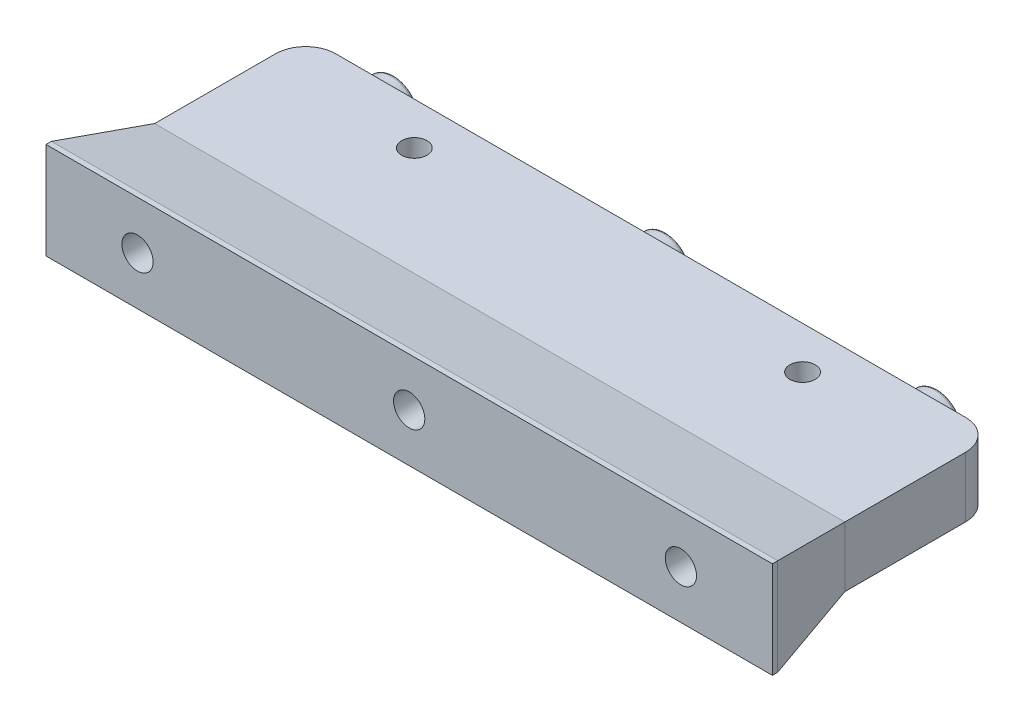
from build123d import *

# Parameters (mm, degrees)
BOSS_EXTRUDE1_DEPTH      = 5
BOSS_EXTRUDE1_DEPTH_BACK = 5
SKETCH2_R                = 2.1
FILLET1_R                = 5
SKETCH14_W               = 120.3
SKETCH14_H               = 16
BOSS_EXTRUDE3_DEPTH      = 15
F_5MBOLTS_DEPTH          = 70.07258863
F_5MBOLTS_DEPTH_BACK     = 70.07258863
SKETCH12_R               = 2.59
SKETCH13_R               = 4.35
SKETCH13_R_2             = 2.59
TOPWASHER_DEPTH          = 2.5
WASHERFILLET_R           = 0.5
CHAMFER1_SIZE            = 3
CHAMFER1_SIZE_2          = 14.113890328


# Read off the part's stored shape, not the designer's step: AdvancedHole1, AdvancedHole2
with BuildPart() as part:
    # Sketch2 → Boss-Extrude1 (new, two sides: drawn at the far end of the back side and taken through both)
    with BuildSketch(Plane(origin=(0, 0, 0), x_dir=(1, 0, 0), z_dir=(0, 1, 0)).offset(-BOSS_EXTRUDE1_DEPTH_BACK)):
        Polygon((-57.15, 5), (-57.15, -33), (57.15, -33), (57.15, 5), (57.15, 7), (-57.15, 7), align=None)
        with Locations(Location((-32.15, 0, 0), (0, 0, 270))):
            Circle(SKETCH2_R, mode=Mode.SUBTRACT)
        with Locations(Location((32.15, 0, 0), (0, 0, 90))):
            Circle(SKETCH2_R, mode=Mode.SUBTRACT)
    extrude(amount=BOSS_EXTRUDE1_DEPTH + BOSS_EXTRUDE1_DEPTH_BACK)

    # AdvancedHole1 outline → AdvancedHole1 (revolve, cut)
    with BuildSketch(Plane(origin=(32.15, 0, 0), x_dir=(1, 0, 0), z_dir=(0, 0, 1))):
        Polygon((2.25, -2.55), (2.1, -2.55), (2.1, -5), (4.7, -5), align=None)
    revolve(axis=Axis((32.15, 0, 0), (0, 1, 0)), mode=Mode.SUBTRACT)

    # AdvancedHole2 outline → AdvancedHole2 (revolve, cut)
    with BuildSketch(Plane(origin=(-32.15, 0, 0), x_dir=(1, 0, 0), z_dir=(0, 0, 1))):
        Polygon((2.25, -2.55), (2.1, -2.55), (2.1, -5), (4.7, -5), align=None)
    revolve(axis=Axis((-32.15, 0, 0), (0, 1, 0)), mode=Mode.SUBTRACT)

    # Fillet1
    fillet1_edges = [part.edges().sort_by_distance(p)[0] for p in [
        (-57.15, 0, -7),
        (57.15, 0, -7),
    ]]
    fillet(fillet1_edges, radius=FILLET1_R)

    # Sketch14 → Boss-Extrude3 (add)
    with BuildSketch(Plane.XY.offset(33)):
        Rectangle(SKETCH14_W, SKETCH14_H)
    extrude(amount=-BOSS_EXTRUDE3_DEPTH)

    # Sketch12 → 5mBolts (cut, two sides: drawn at the far end of the back side and taken through both)
    with BuildSketch(Plane.XY.offset(-F_5MBOLTS_DEPTH_BACK)):
        with Locations((-45, 0)):
            Circle(SKETCH12_R)
        with Locations(Location((45, 0, 0), (0, 0, 180))):
            Circle(SKETCH12_R)
        Circle(SKETCH12_R)
    extrude(amount=F_5MBOLTS_DEPTH + F_5MBOLTS_DEPTH_BACK, mode=Mode.SUBTRACT)

    # Sketch13 → TopWasher (add)
    # profile 1 of 3: a face of its own
    with BuildSketch(Plane(origin=(0, 0, -7), x_dir=(-1, 0, 0), z_dir=(0, 0, -1))):
        with Locations((-45, 0)):
            Circle(SKETCH13_R)
        with Locations((-45, 0)):
            Circle(SKETCH13_R_2, mode=Mode.SUBTRACT)
    # profile 2 of 3: a face of its own
    with BuildSketch(Plane(origin=(0, 0, -7), x_dir=(-1, 0, 0), z_dir=(0, 0, -1))):
        with Locations(Location((45, 0, 0), (0, 0, 180))):
            Circle(SKETCH13_R)
        with Locations(Location((45, 0, 0), (0, 0, 180))):
            Circle(SKETCH13_R_2, mode=Mode.SUBTRACT)
    # profile 3 of 3: a face of its own
    with BuildSketch(Plane(origin=(0, 0, -7), x_dir=(-1, 0, 0), z_dir=(0, 0, -1))):
        Circle(SKETCH13_R)
        with Locations(Location((0, 0, 0), (0, 0, 180))):
            Circle(SKETCH13_R_2, mode=Mode.SUBTRACT)
    extrude(amount=TOPWASHER_DEPTH)

    # WasherFillet
    washerfillet_edges = [part.edges().sort_by_distance(p)[0] for p in [
        (49.35, 0, -9.5),
        (49.35, 0, -7),
        (-49.35, 0, -9.5),
        (-49.35, 0, -7),
        (4.35, 0, -9.5),
        (4.35, 0, -7),
    ]]
    fillet(washerfillet_edges, radius=WASHERFILLET_R)

    # Chamfer1
    # the kernel refuses this chamfer: 14.113890328, 3 mm, written as the material it takes off along each edge
    with BuildSketch(Plane(origin=(-60.15, -44.666446864, 18), x_dir=(0.984670194927414, 0, -0.17442650951506342), z_dir=(0, 1, 0))) as chamfer1_piece_1_section:
        Polygon((CHAMFER1_SIZE * 0.984670194927, -CHAMFER1_SIZE * 0.174426509515), (-CHAMFER1_SIZE_2 * 0.17442650952, -CHAMFER1_SIZE_2 * 0.984670194958), (0, 0), align=None)
    chamfer1_piece_1 = extrude(amount=89.332893728, mode=Mode.PRIVATE)
    chamfer1_piece_1 = split(chamfer1_piece_1, bisect_by=Plane(origin=(-59.308334222, -5, 23.00362874), z_dir=(0, -1, 0)), keep=Keep.TOP, mode=Mode.PRIVATE)
    chamfer1_piece_1 = split(chamfer1_piece_1, bisect_by=Plane(origin=(-57.15, -24.833223432, 23.00362874), z_dir=(-1, 0, 0)), keep=Keep.TOP, mode=Mode.PRIVATE)
    add(chamfer1_piece_1, mode=Mode.SUBTRACT)
    with BuildSketch(Plane(origin=(-60.15, -44.666446864, 18), x_dir=(0.984670194927414, 0, -0.17442650951506342), z_dir=(0, 1, 0))) as chamfer1_piece_2_section:
        Polygon((CHAMFER1_SIZE * 0.984670194927, -CHAMFER1_SIZE * 0.174426509515), (-CHAMFER1_SIZE_2 * 0.17442650952, -CHAMFER1_SIZE_2 * 0.984670194958), (0, 0), align=None)
    chamfer1_piece_2 = extrude(amount=89.332893728, mode=Mode.PRIVATE)
    chamfer1_piece_2 = split(chamfer1_piece_2, bisect_by=Plane(origin=(-59.308334222, 5, 23.00362874), z_dir=(0, -1, 0)), keep=Keep.TOP, mode=Mode.PRIVATE)
    chamfer1_piece_2 = split(chamfer1_piece_2, bisect_by=Plane(origin=(-59.308334222, -5, 23.00362874), z_dir=(0, 1, 0)), keep=Keep.TOP, mode=Mode.PRIVATE)
    chamfer1_piece_2 = split(chamfer1_piece_2, bisect_by=Plane(origin=(-57.15, 0, 23.00362874), z_dir=(-1, 0, 0)), keep=Keep.TOP, mode=Mode.PRIVATE)
    add(chamfer1_piece_2, mode=Mode.SUBTRACT)
    with BuildSketch(Plane(origin=(-60.15, -44.666446864, 18), x_dir=(0.984670194927414, 0, -0.17442650951506342), z_dir=(0, 1, 0))) as chamfer1_piece_3_section:
        Polygon((CHAMFER1_SIZE * 0.984670194927, -CHAMFER1_SIZE * 0.174426509515), (-CHAMFER1_SIZE_2 * 0.17442650952, -CHAMFER1_SIZE_2 * 0.984670194958), (0, 0), align=None)
    chamfer1_piece_3 = extrude(amount=89.332893728, mode=Mode.PRIVATE)
    chamfer1_piece_3 = split(chamfer1_piece_3, bisect_by=Plane(origin=(-59.308334222, 5, 23.00362874), z_dir=(0, 1, 0)), keep=Keep.TOP, mode=Mode.PRIVATE)
    chamfer1_piece_3 = split(chamfer1_piece_3, bisect_by=Plane(origin=(-57.15, 24.833223432, 23.00362874), z_dir=(-1, 0, 0)), keep=Keep.TOP, mode=Mode.PRIVATE)
    add(chamfer1_piece_3, mode=Mode.SUBTRACT)
    with BuildSketch(Plane(origin=(-96.816446864, 8, 18), x_dir=(0, -0.984670194927414, -0.17442650951506347), z_dir=(1, 0, 0))) as chamfer1_piece_4_section:
        Polygon((CHAMFER1_SIZE * 0.984670194927, -CHAMFER1_SIZE * 0.174426509515), (-CHAMFER1_SIZE_2 * 0.17442650952, -CHAMFER1_SIZE_2 * 0.984670194958), (0, 0), align=None)
    chamfer1_piece_4 = extrude(amount=193.632893728, mode=Mode.PRIVATE)
    chamfer1_piece_4 = split(chamfer1_piece_4, bisect_by=Plane(origin=(-76.983223432, 5, 23.00362874), z_dir=(0, 1, 0)), keep=Keep.TOP, mode=Mode.PRIVATE)
    chamfer1_piece_4 = split(chamfer1_piece_4, bisect_by=Plane(origin=(-57.15, 7.158334222, 23.00362874), z_dir=(-1, 0, 0)), keep=Keep.TOP, mode=Mode.PRIVATE)
    add(chamfer1_piece_4, mode=Mode.SUBTRACT)
    with BuildSketch(Plane(origin=(-96.816446864, 8, 18), x_dir=(0, -0.984670194927414, -0.17442650951506347), z_dir=(1, 0, 0))) as chamfer1_piece_5_section:
        Polygon((CHAMFER1_SIZE * 0.984670194927, -CHAMFER1_SIZE * 0.174426509515), (-CHAMFER1_SIZE_2 * 0.17442650952, -CHAMFER1_SIZE_2 * 0.984670194958), (0, 0), align=None)
    chamfer1_piece_5 = extrude(amount=193.632893728, mode=Mode.PRIVATE)
    chamfer1_piece_5 = split(chamfer1_piece_5, bisect_by=Plane(origin=(0, 5, 23.00362874), z_dir=(0, 1, 0)), keep=Keep.TOP, mode=Mode.PRIVATE)
    chamfer1_piece_5 = split(chamfer1_piece_5, bisect_by=Plane(origin=(-57.15, 7.158334222, 23.00362874), z_dir=(1, 0, 0)), keep=Keep.TOP, mode=Mode.PRIVATE)
    chamfer1_piece_5 = split(chamfer1_piece_5, bisect_by=Plane(origin=(57.15, 7.158334222, 23.00362874), z_dir=(-1, 0, 0)), keep=Keep.TOP, mode=Mode.PRIVATE)
    add(chamfer1_piece_5, mode=Mode.SUBTRACT)
    with BuildSketch(Plane(origin=(-96.816446864, 8, 18), x_dir=(0, -0.984670194927414, -0.17442650951506347), z_dir=(1, 0, 0))) as chamfer1_piece_6_section:
        Polygon((CHAMFER1_SIZE * 0.984670194927, -CHAMFER1_SIZE * 0.174426509515), (-CHAMFER1_SIZE_2 * 0.17442650952, -CHAMFER1_SIZE_2 * 0.984670194958), (0, 0), align=None)
    chamfer1_piece_6 = extrude(amount=193.632893728, mode=Mode.PRIVATE)
    chamfer1_piece_6 = split(chamfer1_piece_6, bisect_by=Plane(origin=(76.983223432, 5, 23.00362874), z_dir=(0, 1, 0)), keep=Keep.TOP, mode=Mode.PRIVATE)
    chamfer1_piece_6 = split(chamfer1_piece_6, bisect_by=Plane(origin=(57.15, 7.158334222, 23.00362874), z_dir=(1, 0, 0)), keep=Keep.TOP, mode=Mode.PRIVATE)
    add(chamfer1_piece_6, mode=Mode.SUBTRACT)
    with BuildSketch(Plane(origin=(60.15, 44.666446864, 18), x_dir=(-0.984670194927414, 0, -0.17442650951506342), z_dir=(0, -1, 0))) as chamfer1_piece_7_section:
        Polygon((CHAMFER1_SIZE * 0.984670194927, -CHAMFER1_SIZE * 0.174426509515), (-CHAMFER1_SIZE_2 * 0.17442650952, -CHAMFER1_SIZE_2 * 0.984670194958), (0, 0), align=None)
    chamfer1_piece_7 = extrude(amount=89.332893728, mode=Mode.PRIVATE)
    chamfer1_piece_7 = split(chamfer1_piece_7, bisect_by=Plane(origin=(59.308334222, 5, 23.00362874), z_dir=(0, 1, 0)), keep=Keep.TOP, mode=Mode.PRIVATE)
    chamfer1_piece_7 = split(chamfer1_piece_7, bisect_by=Plane(origin=(57.15, 24.833223432, 23.00362874), z_dir=(1, 0, 0)), keep=Keep.TOP, mode=Mode.PRIVATE)
    add(chamfer1_piece_7, mode=Mode.SUBTRACT)
    with BuildSketch(Plane(origin=(60.15, 44.666446864, 18), x_dir=(-0.984670194927414, 0, -0.17442650951506342), z_dir=(0, -1, 0))) as chamfer1_piece_8_section:
        Polygon((CHAMFER1_SIZE * 0.984670194927, -CHAMFER1_SIZE * 0.174426509515), (-CHAMFER1_SIZE_2 * 0.17442650952, -CHAMFER1_SIZE_2 * 0.984670194958), (0, 0), align=None)
    chamfer1_piece_8 = extrude(amount=89.332893728, mode=Mode.PRIVATE)
    chamfer1_piece_8 = split(chamfer1_piece_8, bisect_by=Plane(origin=(59.308334222, 5, 23.00362874), z_dir=(0, -1, 0)), keep=Keep.TOP, mode=Mode.PRIVATE)
    chamfer1_piece_8 = split(chamfer1_piece_8, bisect_by=Plane(origin=(59.308334222, -5, 23.00362874), z_dir=(0, 1, 0)), keep=Keep.TOP, mode=Mode.PRIVATE)
    chamfer1_piece_8 = split(chamfer1_piece_8, bisect_by=Plane(origin=(57.15, 0, 23.00362874), z_dir=(1, 0, 0)), keep=Keep.TOP, mode=Mode.PRIVATE)
    add(chamfer1_piece_8, mode=Mode.SUBTRACT)
    with BuildSketch(Plane(origin=(60.15, 44.666446864, 18), x_dir=(-0.984670194927414, 0, -0.17442650951506342), z_dir=(0, -1, 0))) as chamfer1_piece_9_section:
        Polygon((CHAMFER1_SIZE * 0.984670194927, -CHAMFER1_SIZE * 0.174426509515), (-CHAMFER1_SIZE_2 * 0.17442650952, -CHAMFER1_SIZE_2 * 0.984670194958), (0, 0), align=None)
    chamfer1_piece_9 = extrude(amount=89.332893728, mode=Mode.PRIVATE)
    chamfer1_piece_9 = split(chamfer1_piece_9, bisect_by=Plane(origin=(59.308334222, -5, 23.00362874), z_dir=(0, -1, 0)), keep=Keep.TOP, mode=Mode.PRIVATE)
    chamfer1_piece_9 = split(chamfer1_piece_9, bisect_by=Plane(origin=(57.15, -24.833223432, 23.00362874), z_dir=(1, 0, 0)), keep=Keep.TOP, mode=Mode.PRIVATE)
    add(chamfer1_piece_9, mode=Mode.SUBTRACT)
    with BuildSketch(Plane(origin=(96.816446864, -8, 18), x_dir=(0, 0.984670194927414, -0.17442650951506347), z_dir=(-1, 0, 0))) as chamfer1_piece_10_section:
        Polygon((CHAMFER1_SIZE * 0.984670194927, -CHAMFER1_SIZE * 0.174426509515), (-CHAMFER1_SIZE_2 * 0.17442650952, -CHAMFER1_SIZE_2 * 0.984670194958), (0, 0), align=None)
    chamfer1_piece_10 = extrude(amount=193.632893728, mode=Mode.PRIVATE)
    chamfer1_piece_10 = split(chamfer1_piece_10, bisect_by=Plane(origin=(76.983223432, -5, 23.00362874), z_dir=(0, -1, 0)), keep=Keep.TOP, mode=Mode.PRIVATE)
    chamfer1_piece_10 = split(chamfer1_piece_10, bisect_by=Plane(origin=(57.15, -7.158334222, 23.00362874), z_dir=(1, 0, 0)), keep=Keep.TOP, mode=Mode.PRIVATE)
    add(chamfer1_piece_10, mode=Mode.SUBTRACT)
    with BuildSketch(Plane(origin=(96.816446864, -8, 18), x_dir=(0, 0.984670194927414, -0.17442650951506347), z_dir=(-1, 0, 0))) as chamfer1_piece_11_section:
        Polygon((CHAMFER1_SIZE * 0.984670194927, -CHAMFER1_SIZE * 0.174426509515), (-CHAMFER1_SIZE_2 * 0.17442650952, -CHAMFER1_SIZE_2 * 0.984670194958), (0, 0), align=None)
    chamfer1_piece_11 = extrude(amount=193.632893728, mode=Mode.PRIVATE)
    chamfer1_piece_11 = split(chamfer1_piece_11, bisect_by=Plane(origin=(0, -5, 23.00362874), z_dir=(0, -1, 0)), keep=Keep.TOP, mode=Mode.PRIVATE)
    chamfer1_piece_11 = split(chamfer1_piece_11, bisect_by=Plane(origin=(-57.15, -7.158334222, 23.00362874), z_dir=(1, 0, 0)), keep=Keep.TOP, mode=Mode.PRIVATE)
    chamfer1_piece_11 = split(chamfer1_piece_11, bisect_by=Plane(origin=(57.15, -7.158334222, 23.00362874), z_dir=(-1, 0, 0)), keep=Keep.TOP, mode=Mode.PRIVATE)
    add(chamfer1_piece_11, mode=Mode.SUBTRACT)
    with BuildSketch(Plane(origin=(96.816446864, -8, 18), x_dir=(0, 0.984670194927414, -0.17442650951506347), z_dir=(-1, 0, 0))) as chamfer1_piece_12_section:
        Polygon((CHAMFER1_SIZE * 0.984670194927, -CHAMFER1_SIZE * 0.174426509515), (-CHAMFER1_SIZE_2 * 0.17442650952, -CHAMFER1_SIZE_2 * 0.984670194958), (0, 0), align=None)
    chamfer1_piece_12 = extrude(amount=193.632893728, mode=Mode.PRIVATE)
    chamfer1_piece_12 = split(chamfer1_piece_12, bisect_by=Plane(origin=(-76.983223432, -5, 23.00362874), z_dir=(0, -1, 0)), keep=Keep.TOP, mode=Mode.PRIVATE)
    chamfer1_piece_12 = split(chamfer1_piece_12, bisect_by=Plane(origin=(-57.15, -7.158334222, 23.00362874), z_dir=(-1, 0, 0)), keep=Keep.TOP, mode=Mode.PRIVATE)
    add(chamfer1_piece_12, mode=Mode.SUBTRACT)


solid = part.part
